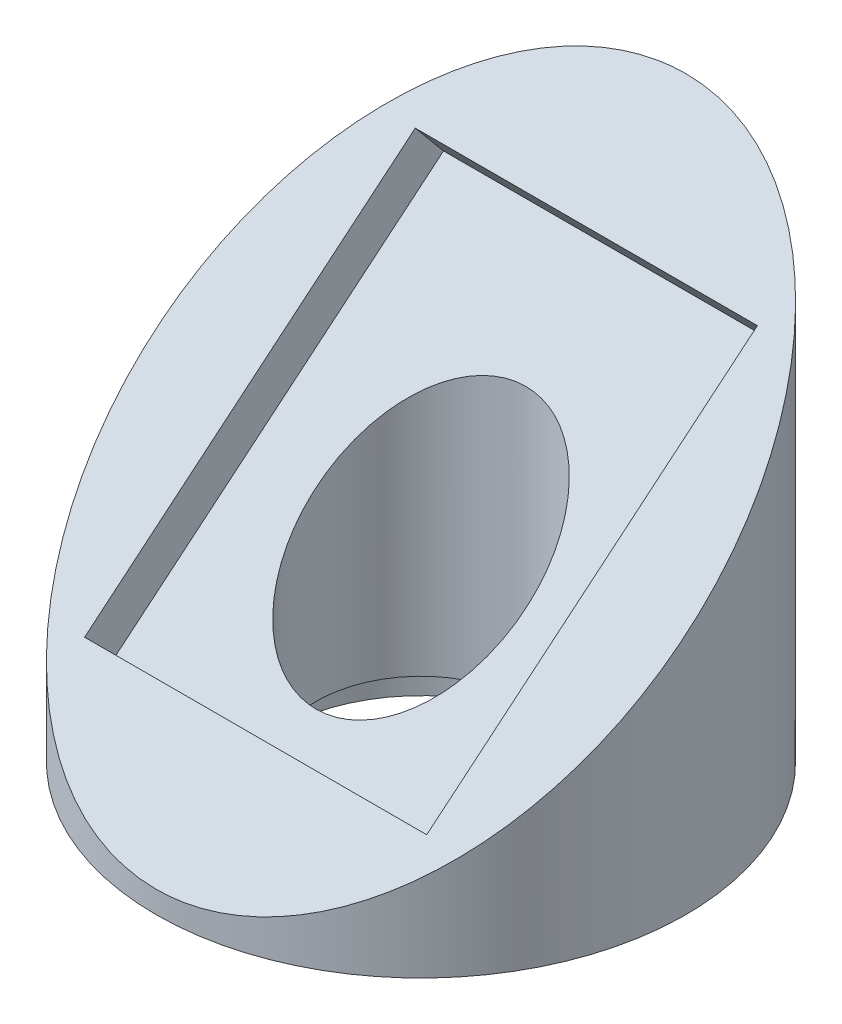
from build123d import *

# Parameters (mm, degrees)
SKETCH2_R           = 12
SKETCH2_R_2         = 7.5
SKETCH2_R_3         = 6.5
SKETCH2_R_4         = 4.75
BOSS_EXTRUDE2_DEPTH = 1
SKETCH2_4_R         = 7.5
SKETCH2_4_R_2       = 6.5
BOSS_EXTRUDE3_DEPTH = 3
BOSS_EXTRUDE4_START = 20
SKETCH2_5_R         = 12
SKETCH2_5_R_2       = 4.75
BOSS_EXTRUDE4_DEPTH = 20
CUT_EXTRUDE1_START  = -12.0000001
CUT_EXTRUDE1_DEPTH  = 24.0000001
CUT_EXTRUDE5_DEPTH  = 2
SKETCH11_W          = 15.5
SKETCH11_H          = 2
CUT_EXTRUDE6_DEPTH  = 18
THREAD2_PITCH       = 1


# Read off the part's stored shape, not the designer's step: Cut-Extrude1
with BuildPart() as part:
    # Sketch2 → Boss-Extrude2 (new body)
    # profile 1 of 3: a face of its own
    with BuildSketch(Plane(origin=(0, 0, 0), x_dir=(1, 0, 0), z_dir=(0, 1, 0))):
        with Locations(Location((0, 0, 0), (0, 0, 270))):
            Circle(SKETCH2_R)
        Circle(SKETCH2_R_2, mode=Mode.SUBTRACT)
    # profile 2 of 3: a face of its own
    with BuildSketch(Plane(origin=(0, 0, 0), x_dir=(1, 0, 0), z_dir=(0, 1, 0))):
        Circle(SKETCH2_R_2)
        Circle(SKETCH2_R_3, mode=Mode.SUBTRACT)
    # profile 3 of 3: a face of its own
    with BuildSketch(Plane(origin=(0, 0, 0), x_dir=(1, 0, 0), z_dir=(0, 1, 0))):
        Circle(SKETCH2_R_3)
        with Locations(Location((0, 0, 0), (0, 0, 270))):
            Circle(SKETCH2_R_4, mode=Mode.SUBTRACT)
    extrude(amount=-BOSS_EXTRUDE2_DEPTH)

    # Sketch2<4> → Boss-Extrude3 (add)
    with BuildSketch(Plane(origin=(0, 0, 0), x_dir=(1, 0, 0), z_dir=(0, 1, 0))):
        with Locations(Location((0, 0, 0), (0, 0, 270))):
            Circle(SKETCH2_4_R)
        with Locations(Location((0, 0, 0), (0, 0, 270))):
            Circle(SKETCH2_4_R_2, mode=Mode.SUBTRACT)
    extrude(amount=-BOSS_EXTRUDE3_DEPTH)

    # Sketch2<5> → Boss-Extrude4 (add)
    with BuildSketch(Plane(origin=(0, 0, 0), x_dir=(1, 0, 0), z_dir=(0, 1, 0)).offset(BOSS_EXTRUDE4_START)):
        with Locations(Location((0, 0, 0), (0, 0, 270))):
            Circle(SKETCH2_5_R)
        with Locations(Location((0, 0, 0), (0, 0, 270))):
            Circle(SKETCH2_5_R_2, mode=Mode.SUBTRACT)
    extrude(amount=-BOSS_EXTRUDE4_DEPTH)

    # Cut-Extrude1 outline → Cut-Extrude1 (cut)
    with BuildSketch(Plane(origin=(0, 0, 0), x_dir=(0, 0, -1), z_dir=(1, 0, 0)).offset(CUT_EXTRUDE1_START)):
        Polygon((-12, 20), (-12, 0), (12, 20), align=None)
    extrude(amount=CUT_EXTRUDE1_DEPTH, mode=Mode.SUBTRACT)

    # Sketch10 → Cut-Extrude5 (cut)
    with BuildSketch(Plane(origin=(0, 5.901639344, 4.918032787), x_dir=(1, 0, 0), z_dir=(0, 0.768221279597376, 0.6401843996644798))):
        with BuildLine():
            Line((-4.75, 6.401843997), (-7.75, 6.401843997))
            Line((-7.75, 6.401843997), (-7.75, -3.348156003))
            Line((-7.75, -3.348156003), (7.75, -3.348156003))
            Line((7.75, -3.348156003), (7.75, 6.401843997))
            Line((7.75, 6.401843997), (4.75, 6.401843997))
            add(Edge.make_bspline(
                [(-4.75, 6.401843997), (-4.75, 0.21872967), (0, 0.21872967), (4.75, 0.21872967), (4.75, 6.401843997)],
                knots=[1.570796327, 1.570796327, 1.570796327, 3.141592654, 3.141592654, 4.71238898, 4.71238898, 4.71238898], degree=2, weights=[1, 0.707106781, 1, 0.707106781, 1]))
        make_face()
        with BuildLine():
            Line((-7.75, 16.151843997), (-7.75, 6.401843997))
            Line((-7.75, 6.401843997), (-4.75, 6.401843997))
            add(Edge.make_bspline(
                [(0, 12.584958323), (-4.75, 12.584958323), (-4.75, 6.401843997)],
                knots=[0, 0, 0, 1.570796327, 1.570796327, 1.570796327], degree=2, weights=[1, 0.707106781, 1]))
            add(Edge.make_bspline(
                [(4.75, 6.401843997), (4.75, 12.584958323), (0, 12.584958323)],
                knots=[4.71238898, 4.71238898, 4.71238898, 6.283185307, 6.283185307, 6.283185307], degree=2, weights=[1, 0.707106781, 1]))
            Line((4.75, 6.401843997), (7.75, 6.401843997))
            Line((7.75, 6.401843997), (7.75, 16.151843997))
            Line((7.75, 16.151843997), (-7.75, 16.151843997))
        make_face()
    extrude(amount=-CUT_EXTRUDE5_DEPTH, mode=Mode.SUBTRACT)

    # Sketch11 → Cut-Extrude6 (cut)
    with BuildSketch(Plane(origin=(0, -2.143437241, 2.572124689), x_dir=(-1, 0, 0), z_dir=(0, 0.6401843996644799, -0.7682212795973757))):
        with Locations((0, 6.682212796)):
            Rectangle(SKETCH11_W, SKETCH11_H)
    extrude(amount=CUT_EXTRUDE6_DEPTH, mode=Mode.SUBTRACT)

    # Thread2: the profile of Thread Profile2 profile screwed along a right-hand helix of 2 turns, 8 arcs to a turn; built about Z, then put on its axis
    thread2_z = Axis((0, 0, 0), (0, 0, 1))
    thread2_corners = [(7.4997, 0, -0.000173205), (8.041265875, 0, 0.312499999), (8.041265875, 0, 0.437499999), (7.4997, 0, 0.750173202)]
    with BuildLine(mode=Mode.PRIVATE) as thread2_profile:
        Line(thread2_corners[0], thread2_corners[1])
        Line(thread2_corners[1], thread2_corners[2])
        Line(thread2_corners[2], thread2_corners[3])
        Line(thread2_corners[3], thread2_corners[0])
    thread2_cap = Face(thread2_profile.wire())
    thread2_turn_angles = [0, 22.5, 45, 67.5, 90, 112.5, 135, 157.5, 180, 202.5, 225, 247.5, 270, 292.5, 315, 337.5, 360]
    thread2_turn_weights = [1, 0.9238795325112867, 1, 0.9238795325112867, 1, 0.9238795325112867, 1, 0.9238795325112867, 1, 0.9238795325112867, 1, 0.9238795325112867, 1, 0.9238795325112867, 1, 0.9238795325112867, 1]
    thread2_turn_rails = [Edge.make_bspline([Vector(p[0], p[1], 0).rotate(thread2_z, thread2_turn_angles[k]) / thread2_turn_weights[k] + Vector(0, 0, p[2] + THREAD2_PITCH * thread2_turn_angles[k] / 360) for k in range(17)], [0, 0, 0, 1, 1, 2, 2, 3, 3, 4, 4, 5, 5, 6, 6, 7, 7, 8, 8, 8], 2, thread2_turn_weights) for p in thread2_corners]
    thread2_turn_sides = [Face.make_surface_from_curves(thread2_turn_rails[p[0]], thread2_turn_rails[p[1]]) for p in [(0, 1), (1, 2), (2, 3), (3, 0)]]
    thread2 = Plane(origin=(0, -3, 0), x_dir=(1, 0, 0), z_dir=(0, 1, 0)) * Solid(Shell([*[p.moved(Location((0, 0, THREAD2_PITCH * i))) for i in range(2) for p in thread2_turn_sides], thread2_cap, thread2_cap.rotate(thread2_z, 720).moved(Location((0, 0, THREAD2_PITCH * 720 / 360)))]))
    add(thread2)


solid = part.part
